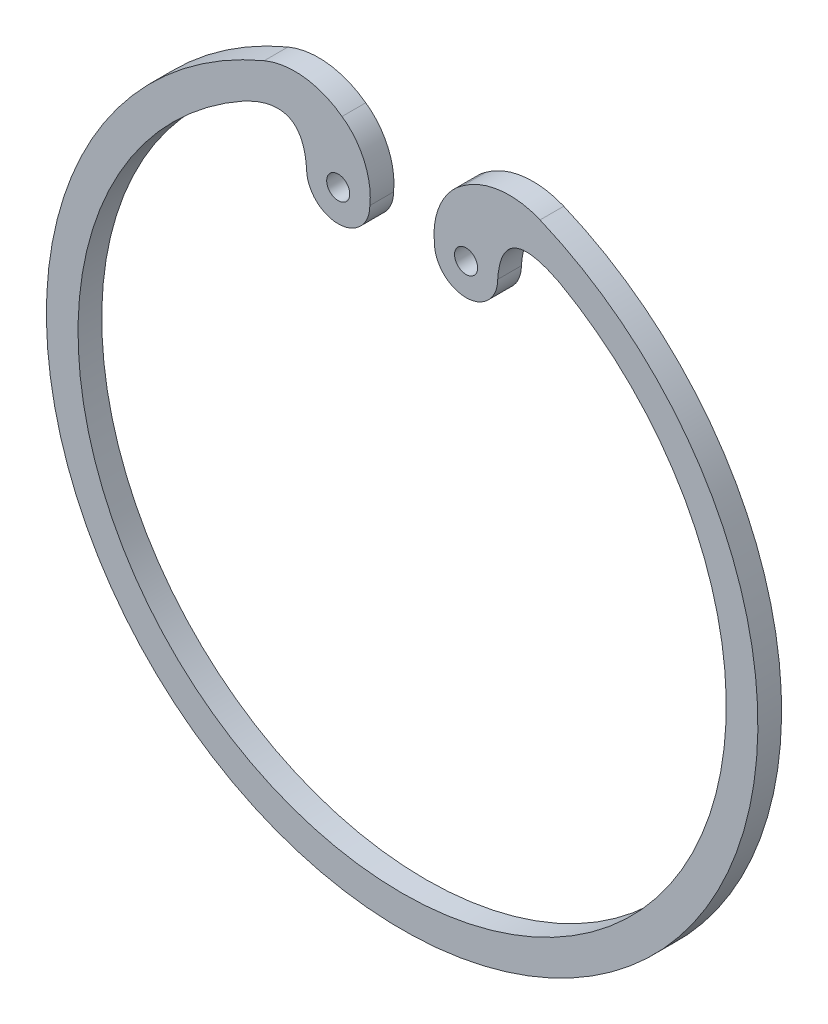
from build123d import *

# Parameters (mm, degrees)
SKETCH1_R            = 45
SKETCH1_R_2          = 41
BOSS_EXTRUDE1_DEPTH  = 3
SKETCH2_R            = 1.459793725
BOSS_EXTRUDE2_DEPTH  = 3
CUT_EXTRUDE1_DEPTH   = 3
FILLET1_R            = 10
FILLET1_OF_MIRROR1_R = 10


with BuildPart() as part:
    # Sketch1 → Boss-Extrude1 (new body)
    with BuildSketch(Plane.XY):
        Circle(SKETCH1_R)
        Circle(SKETCH1_R_2, mode=Mode.SUBTRACT)
    extrude(amount=BOSS_EXTRUDE1_DEPTH)

    # Sketch2 → Boss-Extrude2 (add)
    with BuildSketch(Plane.XY.offset(3)):
        with BuildLine():
            Line((-15.668886268, 42.183954332), (-19.883661907, 35.855822249))
            add(Edge.make_bspline(
                [(-12.086416771, 32.285039051), (-12.597852714, 39.589288788), (-19.883661907, 35.855822249)],
                knots=[0, 0, 0, 1, 1, 1], degree=2))
            ThreePointArc((-12.086416771, 32.285039051), (-8.086416771, 28.285039051), (-4.086416771, 32.285039051))
            add(Edge.make_bspline(
                [(-4.086416771, 32.285039051), (-3.775529113, 34.928467106), (-6.013218517, 41.206349148), (-12.686993609, 42.383352938), (-15.668886268, 42.183954332)],
                knots=[0, 0, 0, 0, 0.461232636, 1, 1, 1, 1], degree=3))
        make_face()
        with Locations((-8.086416771, 32.285039051)):
            Circle(SKETCH2_R, mode=Mode.SUBTRACT)
    boss_extrude2 = extrude(amount=-BOSS_EXTRUDE2_DEPTH)

    # Sketch3 → Cut-Extrude1 (cut)
    with BuildSketch(Plane.XY.offset(3)):
        Polygon((0, 45), (0, 37.437139849), (-7.602836832, 40.288917485), (-11.716734304, 43.447878398), (-6.589372727, 48.458841459), align=None)
    cut_extrude1 = extrude(amount=-CUT_EXTRUDE1_DEPTH, mode=Mode.SUBTRACT)

    # Fillet1
    # the kernel refuses this fillet: 10 mm, written as the material it takes off along each edge
    with BuildSketch(Plane(origin=(-11.716734304, 43.447878398, 18.140851252), x_dir=(-0.9457987516283185, -0.32475332395268036, 0), z_dir=(0, 0, -1))) as fillet1_piece_1:
        with BuildLine():
            CenterArc((5.383413779, -9.977332791), FILLET1_R, 86.141498066, 59.431279914)
            Line((-2.865036036, -4.323743166), (-3.030005033, -4.210671374))
            ThreePointArc((-3.030005033, -4.210671374), (-1.599238142, -2.051398055), (-0.166720124, 0.110473528))
            Line((-0.166720124, 0.110473528), (-0.013458534, 0.199546656))
            ThreePointArc((-0.013458534, 0.199546656), (3.02817025, 0.30200244), (6.069799035, 0.199546656))
            Line((6.069799035, 0.199546656), (6.056340501, 0))
        make_face()
    extrude(amount=33.281702504, mode=Mode.SUBTRACT)

    # Mirror1: Boss-Extrude2, Cut-Extrude1 across plane
    add(boss_extrude2.mirror(Plane(origin=(0, 0, 0), x_dir=(0, 0, 1), z_dir=(1, 0, 0))))
    add(cut_extrude1.mirror(Plane(origin=(0, 0, 0), x_dir=(0, 0, 1), z_dir=(1, 0, 0))), mode=Mode.SUBTRACT)

    # Fillet1 of Mirror1
    # the kernel refuses this fillet: 10 mm, written as the material it takes off along each edge
    with BuildSketch(Plane(origin=(11.716734304, 43.447878398, 18.140851252), x_dir=(0.9457987516283181, -0.324753323952681, 0), z_dir=(0, 0, -1))) as fillet1_of_mirror1_piece_1:
        with BuildLine():
            CenterArc((5.383413779, 9.977332791), FILLET1_OF_MIRROR1_R, 214.42722202, 59.431279914)
            Line((-2.865036036, 4.323743166), (-3.030005033, 4.210671374))
            ThreePointArc((-3.030005033, 4.210671374), (-1.599238142, 2.051398055), (-0.166720124, -0.110473528))
            Line((-0.166720124, -0.110473528), (-0.013458534, -0.199546656))
            ThreePointArc((-0.013458534, -0.199546656), (3.02817025, -0.30200244), (6.069799035, -0.199546656))
            Line((6.069799035, -0.199546656), (6.056340501, 0))
        make_face()
    extrude(amount=33.281702504, mode=Mode.SUBTRACT)


solid = part.part
